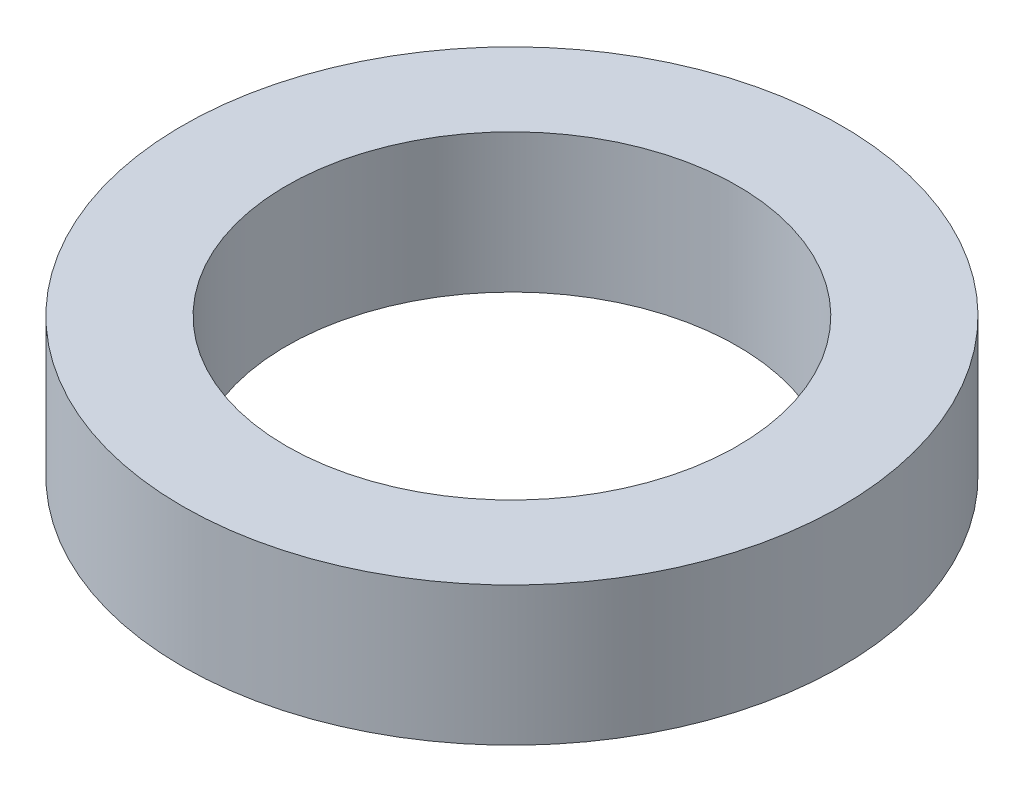
from build123d import *

# Parameters (mm, degrees)
SKETCH1_R           = 47.5
BOSS_EXTRUDE1_DEPTH = 20
SKETCH2_R           = 32.5
CUT_EXTRUDE1_DEPTH  = 71.089228844


with BuildPart() as part:
    # Sketch1 → Boss-Extrude1 (new body)
    with BuildSketch(Plane(origin=(0, 0, 0), x_dir=(1, 0, 0), z_dir=(0, 1, 0))):
        Circle(SKETCH1_R)
    extrude(amount=BOSS_EXTRUDE1_DEPTH)

    # Sketch2 → Cut-Extrude1 (cut, through all)
    with BuildSketch(Plane(origin=(0, 0, 0), x_dir=(1, 0, 0), z_dir=(0, 1, 0))):
        Circle(SKETCH2_R)
    extrude(amount=CUT_EXTRUDE1_DEPTH, mode=Mode.SUBTRACT)


solid = part.part
